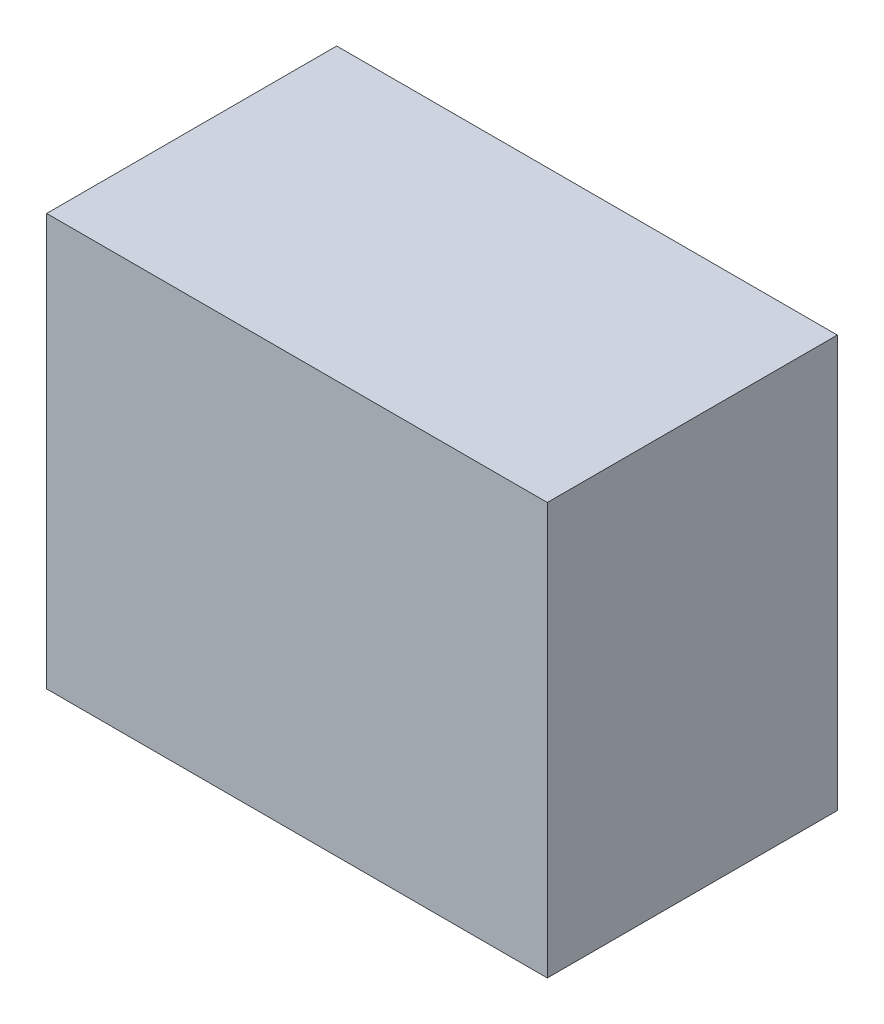
from build123d import *

# Parameters (mm, degrees)
SKETCH3_W                      = 21.924187445
SKETCH3_H                      = 19.837641971
BOSS_EXTRUDE1_DEPTH            = 6.35
SKETCH4_R                      = 3.175
CUT_EXTRUDE1_DEPTH             = 9.525
SKETCH5_R                      = 3.175
CUT_EXTRUDE5_DEPTH             = 9.525
CUT_EXTRUDE5_DIRECTION_2_REACH = 27.174
SKETCH6_R                      = 3.175
CUT_EXTRUDE6_DEPTH             = 9.525
SKETCH7_W                      = 12.7
SKETCH7_H                      = 1.803641971
CUT_EXTRUDE7_DEPTH             = 31.241106695


with BuildPart() as part:
    # Sketch3 → Boss-Extrude1 (new, symmetric)
    with BuildSketch(Plane.XY):
        with Locations((10.962093723, -9.918820986)):
            Rectangle(SKETCH3_W, SKETCH3_H)
    extrude(amount=BOSS_EXTRUDE1_DEPTH, both=True)

    # Sketch4 → Cut-Extrude1 (cut)
    with BuildSketch(Plane.ZY):
        with Locations((0, -6.35)):
            Circle(SKETCH4_R)
    extrude(amount=-CUT_EXTRUDE1_DEPTH, mode=Mode.SUBTRACT)

    # Sketch5 → Cut-Extrude5 (cut)
    with BuildSketch(Plane(origin=(7.787093723, -19.837641971, 0), x_dir=(-0.8660254037844382, 0.500000000000001, 0), z_dir=(-0.500000000000001, -0.8660254037844382, 0))):
        Circle(SKETCH5_R)
    extrude(amount=-CUT_EXTRUDE5_DEPTH, mode=Mode.SUBTRACT)

    # Sketch5 → Cut-Extrude5 direction 2 (cut, up to next)
    with BuildSketch(Plane(origin=(7.787093723, -19.837641971, 0), x_dir=(-0.8660254037844382, 0.500000000000001, 0), z_dir=(-0.500000000000001, -0.8660254037844382, 0)), mode=Mode.PRIVATE) as cut_extrude5_direction_2_sk1:
        Circle(SKETCH5_R)
    cut_extrude5_direction_2_tool1 = extrude(cut_extrude5_direction_2_sk1.sketch, amount=CUT_EXTRUDE5_DIRECTION_2_REACH, mode=Mode.PRIVATE) & part.part
    add(cut_extrude5_direction_2_tool1.solids().sort_by_distance((7.787094, -19.837642, 0))[0], mode=Mode.SUBTRACT)

    # Sketch6 → Cut-Extrude6 (cut)
    with BuildSketch(Plane(origin=(0, 0, -6.35), x_dir=(-1, 0, 0), z_dir=(0, 0, -1))):
        with Locations((-15.574187445, -6.35)):
            Circle(SKETCH6_R)
    extrude(amount=-CUT_EXTRUDE6_DEPTH, mode=Mode.SUBTRACT)

    # Sketch7 → Cut-Extrude7 (cut, through all)
    with BuildSketch(Plane(origin=(21.924187445, 0, 0), x_dir=(0, 0, -1), z_dir=(1, 0, 0))):
        with Locations((0, -18.935820986)):
            Rectangle(SKETCH7_W, SKETCH7_H)
    extrude(amount=-CUT_EXTRUDE7_DEPTH, mode=Mode.SUBTRACT)


solid = part.part
